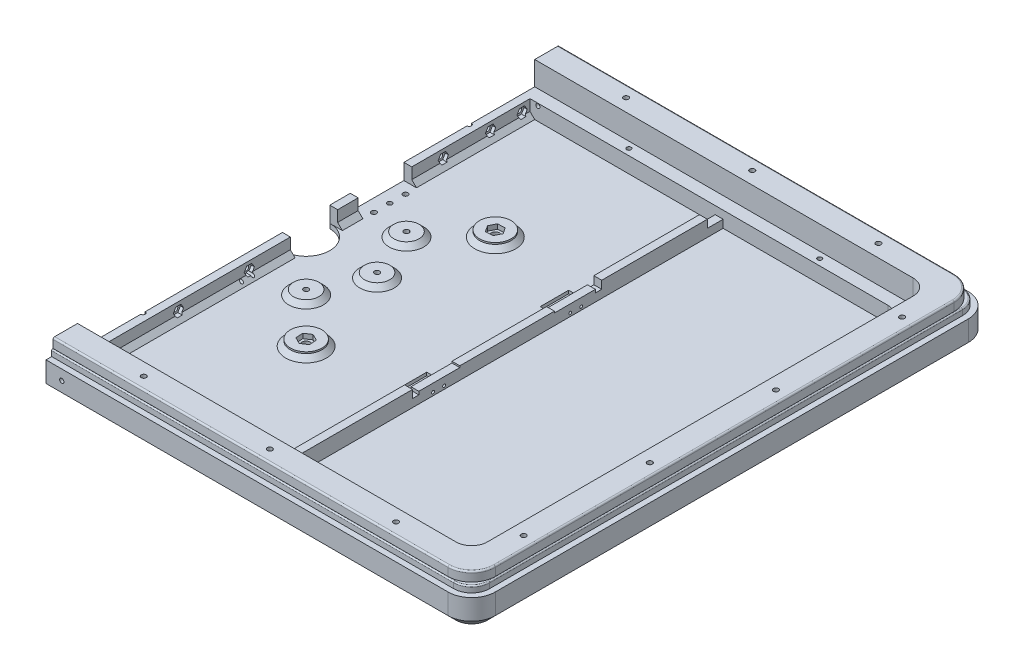
from build123d import *

# Parameters (mm, degrees)
SKETCH1_W                       = 540
SKETCH1_H                       = 330
BOSS_EXTRUDE1_DEPTH             = 3
SKETCH2_W                       = 540
SKETCH2_H                       = 330
SKETCH2_W_2                     = 500
SKETCH2_H_2                     = 290
BOSS_EXTRUDE2_DEPTH             = 25
FILLET1_R                       = 15
SKETCH4_R                       = 1.6
CUT_EXTRUDE1_DEPTH              = 28
SKETCH5_R                       = 15
CUT_EXTRUDE2_DEPTH              = 3
CHAMFER1_SIZE                   = 5
SKETCH7_R                       = 2.6
CUT_EXTRUDE3_DEPTH              = 3
SKETCH9_R                       = 1.6
CUT_EXTRUDE4_DEPTH              = 47
CUT_EXTRUDE5_DEPTH              = 10
FILLET2_R                       = 1
BOSS_EXTRUDE3_DEPTH             = 4
FILLET4_R                       = 0.8
SKETCH23_W                      = 10
SKETCH23_H                      = 130
SKETCH23_W_2                    = 5
SKETCH23_H_2                    = 290
BOSS_EXTRUDE4_DEPTH             = 10
SKETCH24_W                      = 500
SKETCH24_H                      = 290
SKETCH24_W_2                    = 484
SKETCH24_H_2                    = 274
BOSS_EXTRUDE5_DEPTH             = 10
CUT_EXTRUDE6_REACH              = 433.295
SKETCH25_R                      = 0.9
SKETCH26_W                      = 10
SKETCH26_H                      = 18
CUT_EXTRUDE7_DEPTH              = 2
SKETCH27_W                      = 5
SKETCH27_H                      = 30
CUT_EXTRUDE8_DEPTH              = 3
SKETCH28_W                      = 5
SKETCH28_H                      = 60
CUT_EXTRUDE9_DEPTH              = 2
SKETCH29_W                      = 5
SKETCH29_H                      = 4
CUT_EXTRUDE10_DEPTH             = 2
SKETCH31_W                      = 16
SKETCH31_H                      = 34
BOSS_EXTRUDE6_DEPTH             = 53
BOSS_EXTRUDE6_DIRECTION_2_REACH = 318.781
FILLET5_R                       = 15
SKETCH34_R                      = 3
CUT_EXTRUDE11_DEPTH             = 53
SKETCH35_R                      = 8
SKETCH35_R_2                    = 1.6
BOSS_EXTRUDE7_DEPTH             = 3
CHAMFER2_SIZE                   = 3
SKETCH37_W                      = 16
SKETCH37_H                      = 34
CUT_EXTRUDE12_DEPTH             = 63
SKETCH38_R                      = 1.6
SKETCH38_R_2                    = 1.5
CUT_EXTRUDE13_DEPTH             = 90
CHAMFER3_SIZE                   = 3
SKETCH39_R                      = 1.4
CUT_EXTRUDE14_DEPTH             = 8
FILLET6_R                       = 10
FILLET7_R                       = 10
CUT_EXTRUDE15_DEPTH             = 30
CUT_EXTRUDE15_DEPTH_BACK        = 30
SKETCH41_R                      = 5
CUT_EXTRUDE16_DEPTH             = 10
CUT_EXTRUDE16_DEPTH_BACK        = 30
SKETCH42_R                      = 1.6
CUT_EXTRUDE17_DEPTH             = 17
CUT_EXTRUDE17_DEPTH_BACK        = 2
SKETCH45_R                      = 10
SKETCH45_R_2                    = 2.6
BOSS_EXTRUDE8_DEPTH             = 4
CHAMFER4_SIZE                   = 3
CUT_EXTRUDE18_DEPTH             = 3
CUT_EXTRUDE20_REACH             = 429.298
SKETCH52_R                      = 1.35
CUT_EXTRUDE21_REACH             = 319.662
SKETCH51_W                      = 382.039337846
SKETCH51_H                      = 380.550615879
SKETCH53_W                      = 5
SKETCH53_H                      = 10
CUT_EXTRUDE22_DEPTH             = 5


# Some blends are built 0.0001 mm under size
with BuildPart() as part:
    # Sketch1 → Boss-Extrude1 (new body)
    with BuildSketch(Plane(origin=(0, 0, 0), x_dir=(1, 0, 0), z_dir=(0, 1, 0))):
        Rectangle(SKETCH1_W, SKETCH1_H)
    extrude(amount=BOSS_EXTRUDE1_DEPTH)

    # Sketch2 → Boss-Extrude2 (add)
    with BuildSketch(Plane(origin=(0, 3, 0), x_dir=(1, 0, 0), z_dir=(0, 1, 0))):
        Rectangle(SKETCH2_W, SKETCH2_H)
        Rectangle(SKETCH2_W_2, SKETCH2_H_2, mode=Mode.SUBTRACT)
    extrude(amount=BOSS_EXTRUDE2_DEPTH)

    # Fillet1
    fillet1_edges = [part.edges().sort_by_distance(p)[0] for p in [
        (270, 14, 165),
        (-270, 14, 165),
        (-270, 14, -165),
        (270, 14, -165),
    ]]
    fillet(fillet1_edges, radius=FILLET1_R)

    # Sketch4 → Cut-Extrude1 (cut)
    with BuildSketch(Plane(origin=(0, 28, 0), x_dir=(1, 0, 0), z_dir=(0, 1, 0))):
        with Locations(Location((-258, 120, 0), (0, 0, 270))):
            Circle(SKETCH4_R)
        with Locations(Location((-258, 40, 0), (0, 0, 270))):
            Circle(SKETCH4_R)
        with Locations(Location((-210, 153, 0), (0, 0, 270))):
            Circle(SKETCH4_R)
        with Locations(Location((-130, 153, 0), (0, 0, 270))):
            Circle(SKETCH4_R)
        with Locations(Location((-50, 153, 0), (0, 0, 270))):
            Circle(SKETCH4_R)
        with Locations(Location((50, 153, 0), (0, 0, 90))):
            Circle(SKETCH4_R)
        with Locations(Location((130, 153, 0), (0, 0, 90))):
            Circle(SKETCH4_R)
        with Locations(Location((210, 153, 0), (0, 0, 90))):
            Circle(SKETCH4_R)
        with Locations(Location((258, 40, 0), (0, 0, 90))):
            Circle(SKETCH4_R)
        with Locations(Location((258, 120, 0), (0, 0, 90))):
            Circle(SKETCH4_R)
        with Locations(Location((258, -120, 0), (0, 0, 270))):
            Circle(SKETCH4_R)
        with Locations(Location((258, -40, 0), (0, 0, 270))):
            Circle(SKETCH4_R)
        with Locations(Location((210, -153, 0), (0, 0, 270))):
            Circle(SKETCH4_R)
        with Locations(Location((130, -153, 0), (0, 0, 270))):
            Circle(SKETCH4_R)
        with Locations(Location((50, -153, 0), (0, 0, 270))):
            Circle(SKETCH4_R)
        with Locations(Location((-50, -153, 0), (0, 0, 90))):
            Circle(SKETCH4_R)
        with Locations(Location((-130, -153, 0), (0, 0, 90))):
            Circle(SKETCH4_R)
        with Locations(Location((-210, -153, 0), (0, 0, 90))):
            Circle(SKETCH4_R)
        with Locations(Location((-258, -40, 0), (0, 0, 90))):
            Circle(SKETCH4_R)
        with Locations(Location((-258, -120, 0), (0, 0, 90))):
            Circle(SKETCH4_R)
    extrude(amount=-CUT_EXTRUDE1_DEPTH, mode=Mode.SUBTRACT)

    # Sketch5 → Cut-Extrude2 (cut)
    with BuildSketch(Plane(origin=(0, 3, 0), x_dir=(1, 0, 0), z_dir=(0, 1, 0))):
        with Locations(Location((0, 0, 0), (0, 0, 270))):
            Circle(SKETCH5_R)
    extrude(amount=-CUT_EXTRUDE2_DEPTH, mode=Mode.SUBTRACT)

    # Chamfer1
    chamfer1_edges = [part.edges().sort_by_distance(p)[0] for p in [
        (-270, 0, 0),
        (270, 0, 0),
        (0, 0, 165),
        (0, 0, -165),
        (265.606601718, 0, -160.606601718),
        (265.606601718, 0, 160.606601718),
        (-265.606601718, 0, 160.606601718),
        (-265.606601718, 0, -160.606601718),
    ]]
    chamfer(chamfer1_edges, length=CHAMFER1_SIZE)

    # Sketch7 → Cut-Extrude3 (cut)
    with BuildSketch(Plane.XZ):
        with Locations(Location((-60, 60, 0), (0, 0, 270))):
            Circle(SKETCH7_R)
        with Locations(Location((60, 60, 0), (0, 0, 270))):
            Circle(SKETCH7_R)
        with Locations(Location((60, -60, 0), (0, 0, 270))):
            Circle(SKETCH7_R)
        with Locations(Location((-60, -60, 0), (0, 0, 270))):
            Circle(SKETCH7_R)
    extrude(amount=-CUT_EXTRUDE3_DEPTH, mode=Mode.SUBTRACT)

    # Sketch9 → Cut-Extrude4 (cut)
    with BuildSketch(Plane.XZ):
        with Locations(Location((-31.819805153, 31.819805153, 0), (0, 0, 270))):
            Circle(SKETCH9_R)
        with Locations(Location((31.819805153, 31.819805153, 0), (0, 0, 270))):
            Circle(SKETCH9_R)
        with Locations(Location((31.819805153, -31.819805153, 0), (0, 0, 270))):
            Circle(SKETCH9_R)
        with Locations(Location((-31.819805153, -31.819805153, 0), (0, 0, 270))):
            Circle(SKETCH9_R)
        with Locations(Location((45, 0, 0), (0, 0, 270))):
            Circle(SKETCH9_R)
        with Locations(Location((-45, 0, 0), (0, 0, 270))):
            Circle(SKETCH9_R)
    extrude(amount=-CUT_EXTRUDE4_DEPTH, mode=Mode.SUBTRACT)

    # Sketch19 → Cut-Extrude5 (cut)
    with BuildSketch(Plane(origin=(0, 28, 0), x_dir=(1, 0, 0), z_dir=(0, 1, 0))):
        with BuildLine():
            Line((255, -165), (-255, -165))
            ThreePointArc((-255, -165), (-265.606601718, -160.606601718), (-270, -150))
            Line((-270, -150), (-270, 150))
            ThreePointArc((-270, 150), (-265.606601718, 160.606601718), (-255, 165))
            Line((-255, 165), (255, 165))
            ThreePointArc((255, 165), (265.606601718, 160.606601718), (270, 150))
            Line((270, 150), (270, -150))
            ThreePointArc((270, -150), (265.606601718, -160.606601718), (255, -165))
        make_face()
        with BuildLine():
            Line((250.5, 160.5), (-250.5, 160.5))
            ThreePointArc((-250.5, 160.5), (-261.106601718, 156.106601718), (-265.5, 145.5))
            Line((-265.5, 145.5), (-265.5, -145.5))
            ThreePointArc((-265.5, -145.5), (-261.106601718, -156.106601718), (-250.5, -160.5))
            Line((-250.5, -160.5), (250.5, -160.5))
            ThreePointArc((250.5, -160.5), (261.106601718, -156.106601718), (265.5, -145.5))
            Line((265.5, -145.5), (265.5, 145.5))
            ThreePointArc((265.5, 145.5), (261.106601718, 156.106601718), (250.5, 160.5))
        make_face(mode=Mode.SUBTRACT)
    extrude(amount=-CUT_EXTRUDE5_DEPTH, mode=Mode.SUBTRACT)

    # Fillet2
    fillet2_edges = [part.edges().sort_by_distance(p)[0] for p in [
        (-261.106601718, 28, -156.106601718),
        (0, 28, -160.5),
        (261.106601718, 28, -156.106601718),
        (265.5, 28, 0),
        (261.106601718, 28, 156.106601718),
        (0, 28, 160.5),
        (-261.106601718, 28, 156.106601718),
        (-265.5, 28, 0),
    ]]
    fillet(fillet2_edges, radius=FILLET2_R)

    # Sketch20 → Boss-Extrude3 (add)
    with BuildSketch(Plane(origin=(0, 18, 0), x_dir=(1, 0, 0), z_dir=(0, 1, 0))):
        with BuildLine():
            Line((-255, 161.4), (255, 161.4))
            ThreePointArc((255, 161.4), (263.061017306, 158.061017306), (266.4, 150))
            Line((266.4, 150), (266.4, -150))
            ThreePointArc((266.4, -150), (263.061017306, -158.061017306), (255, -161.4))
            Line((255, -161.4), (-255, -161.4))
            ThreePointArc((-255, -161.4), (-263.061017306, -158.061017306), (-266.4, -150))
            Line((-266.4, -150), (-266.4, 150))
            ThreePointArc((-266.4, 150), (-263.061017306, 158.061017306), (-255, 161.4))
        make_face()
        with BuildLine():
            Line((-255, 157.9), (255, 157.9))
            ThreePointArc((255, 157.9), (260.586143571, 155.586143571), (262.9, 150))
            Line((262.9, 150), (262.9, -150))
            ThreePointArc((262.9, -150), (260.586143571, -155.586143571), (255, -157.9))
            Line((255, -157.9), (-255, -157.9))
            ThreePointArc((-255, -157.9), (-260.586143571, -155.586143571), (-262.9, -150))
            Line((-262.9, -150), (-262.9, 150))
            ThreePointArc((-262.9, 150), (-260.586143571, 155.586143571), (-255, 157.9))
        make_face(mode=Mode.SUBTRACT)
    extrude(amount=BOSS_EXTRUDE3_DEPTH)

    # Fillet4
    fillet4_edges = [part.edges().sort_by_distance(p)[0] for p in [
        (-263.061017306, 22, -158.061017306),
        (-266.4, 22, 0),
        (-263.061017306, 22, 158.061017306),
        (0, 22, 161.4),
        (263.061017306, 22, 158.061017306),
        (266.4, 22, 0),
        (263.061017306, 22, -158.061017306),
        (0, 22, -161.4),
    ]]
    fillet(fillet4_edges, radius=FILLET4_R)

    # Sketch23 → Boss-Extrude4 (add)
    with BuildSketch(Plane(origin=(0, 3, 0), x_dir=(1, 0, 0), z_dir=(0, 1, 0))):
        with Locations((0, 80)):
            Rectangle(SKETCH23_W, SKETCH23_H)
        with Locations((0, -80)):
            Rectangle(SKETCH23_W, SKETCH23_H)
        with Locations((125, 0)):
            Rectangle(SKETCH23_W_2, SKETCH23_H_2)
        with Locations((-125, 0)):
            Rectangle(SKETCH23_W_2, SKETCH23_H_2)
    extrude(amount=BOSS_EXTRUDE4_DEPTH)

    # Sketch24 → Boss-Extrude5 (add)
    with BuildSketch(Plane(origin=(0, 3, 0), x_dir=(1, 0, 0), z_dir=(0, 1, 0))):
        Rectangle(SKETCH24_W, SKETCH24_H)
        Rectangle(SKETCH24_W_2, SKETCH24_H_2, mode=Mode.SUBTRACT)
    extrude(amount=BOSS_EXTRUDE5_DEPTH)

    # Cut-Extrude6: up to this face of the body (flat: up to its plane)
    cut_extrude6_end = Plane(part.part.faces().sort_by_distance((-127.5, 8, 0))[0])
    # Sketch25 → Cut-Extrude6 (cut, up to the picked face)
    with BuildSketch(Plane(origin=(127.5, 0, 0), x_dir=(0, 0, -1), z_dir=(1, 0, 0)), mode=Mode.PRIVATE) as cut_extrude6_sk1:
        with Locations(Location((-47, 5, 0), (0, 0, 180))):
            Circle(SKETCH25_R)
    cut_extrude6_tool1 = split(extrude(cut_extrude6_sk1.sketch, amount=-CUT_EXTRUDE6_REACH, mode=Mode.PRIVATE), bisect_by=cut_extrude6_end, keep=Keep.BOTH, mode=Mode.PRIVATE)
    # Sketch25 → Cut-Extrude6 (cut, up to the picked face)
    with BuildSketch(Plane(origin=(127.5, 0, 0), x_dir=(0, 0, -1), z_dir=(1, 0, 0)), mode=Mode.PRIVATE) as cut_extrude6_sk2:
        with Locations(Location((-40, 5, 0), (0, 0, 180))):
            Circle(SKETCH25_R)
    cut_extrude6_tool2 = split(extrude(cut_extrude6_sk2.sketch, amount=-CUT_EXTRUDE6_REACH, mode=Mode.PRIVATE), bisect_by=cut_extrude6_end, keep=Keep.BOTH, mode=Mode.PRIVATE)
    # Sketch25 → Cut-Extrude6 (cut, up to the picked face)
    with BuildSketch(Plane(origin=(127.5, 0, 0), x_dir=(0, 0, -1), z_dir=(1, 0, 0)), mode=Mode.PRIVATE) as cut_extrude6_sk3:
        with Locations(Location((47, 5, 0), (0, 0, 180))):
            Circle(SKETCH25_R)
    cut_extrude6_tool3 = split(extrude(cut_extrude6_sk3.sketch, amount=-CUT_EXTRUDE6_REACH, mode=Mode.PRIVATE), bisect_by=cut_extrude6_end, keep=Keep.BOTH, mode=Mode.PRIVATE)
    # Sketch25 → Cut-Extrude6 (cut, up to the picked face)
    with BuildSketch(Plane(origin=(127.5, 0, 0), x_dir=(0, 0, -1), z_dir=(1, 0, 0)), mode=Mode.PRIVATE) as cut_extrude6_sk4:
        with Locations(Location((40, 5, 0), (0, 0, 180))):
            Circle(SKETCH25_R)
    cut_extrude6_tool4 = split(extrude(cut_extrude6_sk4.sketch, amount=-CUT_EXTRUDE6_REACH, mode=Mode.PRIVATE), bisect_by=cut_extrude6_end, keep=Keep.BOTH, mode=Mode.PRIVATE)
    add(cut_extrude6_tool1.solids().sort_by(Axis((127.5, 5, 47), (-1, 0, 0)))[0], mode=Mode.SUBTRACT)
    add(cut_extrude6_tool2.solids().sort_by(Axis((127.5, 5, 40), (-1, 0, 0)))[0], mode=Mode.SUBTRACT)
    add(cut_extrude6_tool3.solids().sort_by(Axis((127.5, 5, -47), (-1, 0, 0)))[0], mode=Mode.SUBTRACT)
    add(cut_extrude6_tool4.solids().sort_by(Axis((127.5, 5, -40), (-1, 0, 0)))[0], mode=Mode.SUBTRACT)

    # Sketch26 → Cut-Extrude7 (cut)
    with BuildSketch(Plane(origin=(0, 3, 0), x_dir=(1, 0, 0), z_dir=(0, 1, 0))):
        with Locations((-117.5, -45)):
            Rectangle(SKETCH26_W, SKETCH26_H)
        with Locations((-117.5, 45)):
            Rectangle(SKETCH26_W, SKETCH26_H)
        with Locations((117.5, -45)):
            Rectangle(SKETCH26_W, SKETCH26_H)
        with Locations((117.5, 45)):
            Rectangle(SKETCH26_W, SKETCH26_H)
    extrude(amount=-CUT_EXTRUDE7_DEPTH, mode=Mode.SUBTRACT)

    # Sketch27 → Cut-Extrude8 (cut)
    with BuildSketch(Plane(origin=(0, 13, 0), x_dir=(1, 0, 0), z_dir=(0, 1, 0))):
        with Locations((-125, -45)):
            Rectangle(SKETCH27_W, SKETCH27_H)
        with Locations((-125, 45)):
            Rectangle(SKETCH27_W, SKETCH27_H)
        with Locations((125, 45)):
            Rectangle(SKETCH27_W, SKETCH27_H)
        with Locations((125, -45)):
            Rectangle(SKETCH27_W, SKETCH27_H)
    extrude(amount=-CUT_EXTRUDE8_DEPTH, mode=Mode.SUBTRACT)

    # Sketch28 → Cut-Extrude9 (cut)
    with BuildSketch(Plane(origin=(0, 13, 0), x_dir=(1, 0, 0), z_dir=(0, 1, 0))):
        with Locations((-125, 0)):
            Rectangle(SKETCH28_W, SKETCH28_H)
        with Locations((125, 0)):
            Rectangle(SKETCH28_W, SKETCH28_H)
    extrude(amount=-CUT_EXTRUDE9_DEPTH, mode=Mode.SUBTRACT)

    # Sketch29 → Cut-Extrude10 (cut)
    with BuildSketch(Plane(origin=(0, 10, 0), x_dir=(1, 0, 0), z_dir=(0, 1, 0))):
        with Locations((-125, 58)):
            Rectangle(SKETCH29_W, SKETCH29_H)
        with Locations((-125, -58)):
            Rectangle(SKETCH29_W, SKETCH29_H)
        with Locations((125, -58)):
            Rectangle(SKETCH29_W, SKETCH29_H)
        with Locations((125, 58)):
            Rectangle(SKETCH29_W, SKETCH29_H)
    extrude(amount=-CUT_EXTRUDE10_DEPTH, mode=Mode.SUBTRACT)

    # Sketch31 → Boss-Extrude6 (add)
    with BuildSketch(Plane(origin=(0, 13, 0), x_dir=(1, 0, 0), z_dir=(0, 1, 0))):
        with Locations((0, 45)):
            Rectangle(SKETCH31_W, SKETCH31_H)
    extrude(amount=BOSS_EXTRUDE6_DEPTH)

    # Boss-Extrude6 direction 2: up to this face of the body (flat: up to its plane)
    boss_extrude6_direction_2_end = Plane(part.part.faces().sort_by_distance((-63.514526325, 3, 0))[0])
    # Sketch31 → Boss-Extrude6 direction 2 (add, up to the picked face)
    with BuildSketch(Plane(origin=(0, 13, 0), x_dir=(1, 0, 0), z_dir=(0, 1, 0)), mode=Mode.PRIVATE) as boss_extrude6_direction_2_sk1:
        with Locations((0, 45)):
            Rectangle(SKETCH31_W, SKETCH31_H)
    boss_extrude6_direction_2_tool1 = split(extrude(boss_extrude6_direction_2_sk1.sketch, amount=-BOSS_EXTRUDE6_DIRECTION_2_REACH, mode=Mode.PRIVATE), bisect_by=boss_extrude6_direction_2_end, keep=Keep.BOTH, mode=Mode.PRIVATE)
    add(boss_extrude6_direction_2_tool1.solids().sort_by(Axis((0, 13, -45), (0, -1, 0)))[0])

    # Fillet5
    fillet5_edges = [part.edges().sort_by_distance(p)[0] for p in [
        (0, 66, -62),
        (0, 66, -28),
    ]]
    fillet(fillet5_edges, radius=FILLET5_R)

    # Sketch34 → Cut-Extrude11 (cut)
    with BuildSketch(Plane.ZY.offset(8)):
        with Locations((-45, 53)):
            Circle(SKETCH34_R)
    extrude(amount=-CUT_EXTRUDE11_DEPTH, mode=Mode.SUBTRACT)

    # Sketch35 → Boss-Extrude7 (add)
    # profile 1 of 6: a face of its own
    with BuildSketch(Plane(origin=(0, 3, 0), x_dir=(1, 0, 0), z_dir=(0, 1, 0))):
        with Locations(Location((-31.819805153, 31.819805153, 0), (0, 0, 90))):
            Circle(SKETCH35_R)
        with Locations(Location((-31.819805153, 31.819805153, 0), (0, 0, 90))):
            Circle(SKETCH35_R_2, mode=Mode.SUBTRACT)
    # profile 2 of 6: a face of its own
    with BuildSketch(Plane(origin=(0, 3, 0), x_dir=(1, 0, 0), z_dir=(0, 1, 0))):
        with Locations(Location((31.819805153, 31.819805153, 0), (0, 0, 90))):
            Circle(SKETCH35_R)
        with Locations(Location((31.819805153, 31.819805153, 0), (0, 0, 90))):
            Circle(SKETCH35_R_2, mode=Mode.SUBTRACT)
    # profile 3 of 6: a face of its own
    with BuildSketch(Plane(origin=(0, 3, 0), x_dir=(1, 0, 0), z_dir=(0, 1, 0))):
        with Locations(Location((31.819805153, -31.819805153, 0), (0, 0, 90))):
            Circle(SKETCH35_R)
        with Locations(Location((31.819805153, -31.819805153, 0), (0, 0, 90))):
            Circle(SKETCH35_R_2, mode=Mode.SUBTRACT)
    # profile 4 of 6: a face of its own
    with BuildSketch(Plane(origin=(0, 3, 0), x_dir=(1, 0, 0), z_dir=(0, 1, 0))):
        with Locations(Location((-31.819805153, -31.819805153, 0), (0, 0, 90))):
            Circle(SKETCH35_R)
        with Locations(Location((-31.819805153, -31.819805153, 0), (0, 0, 90))):
            Circle(SKETCH35_R_2, mode=Mode.SUBTRACT)
    # profile 5 of 6: a face of its own
    with BuildSketch(Plane(origin=(0, 3, 0), x_dir=(1, 0, 0), z_dir=(0, 1, 0))):
        with Locations(Location((-45, 0, 0), (0, 0, 90))):
            Circle(SKETCH35_R)
        with Locations(Location((-45, 0, 0), (0, 0, 270))):
            Circle(SKETCH35_R_2, mode=Mode.SUBTRACT)
    # profile 6 of 6: a face of its own
    with BuildSketch(Plane(origin=(0, 3, 0), x_dir=(1, 0, 0), z_dir=(0, 1, 0))):
        with Locations(Location((45, 0, 0), (0, 0, 90))):
            Circle(SKETCH35_R)
        with Locations(Location((45, 0, 0), (0, 0, 90))):
            Circle(SKETCH35_R_2, mode=Mode.SUBTRACT)
    extrude(amount=BOSS_EXTRUDE7_DEPTH)

    # Chamfer2
    chamfer2_edges = [part.edges().sort_by_distance(p)[0] for p in [
        (-31.819805153, 3, -23.819805153),
        (-45, 3, 8),
        (31.819805153, 3, -23.819805153),
        (31.819805153, 3, 39.819805153),
        (-31.819805153, 3, 39.819805153),
        (45, 3, 8),
    ]]
    chamfer(chamfer2_edges, length=CHAMFER2_SIZE - 0.0001)  # a hair under: the kernel refuses the full size

    # Sketch37 → Cut-Extrude12 (cut)
    with BuildSketch(Plane(origin=(0, 66, 0), x_dir=(1, 0, 0), z_dir=(0, 1, 0))):
        with Locations((0, 45)):
            Rectangle(SKETCH37_W, SKETCH37_H)
    extrude(amount=-CUT_EXTRUDE12_DEPTH, mode=Mode.SUBTRACT)

    # Sketch38 → Cut-Extrude13 (cut)
    with BuildSketch(Plane(origin=(0, 3, 0), x_dir=(1, 0, 0), z_dir=(0, 1, 0))):
        with Locations(Location((8, 55, 0), (0, 0, 270))):
            Circle(SKETCH38_R)
        with Locations(Location((8, 35, 0), (0, 0, 270))):
            Circle(SKETCH38_R)
        with Locations(Location((-8, 35, 0), (0, 0, 270))):
            Circle(SKETCH38_R)
        with Locations(Location((-8, 55, 0), (0, 0, 270))):
            Circle(SKETCH38_R)
        with Locations(Location((8, 45, 0), (0, 0, 270))):
            Circle(SKETCH38_R_2)
        with Locations(Location((-8, 45, 0), (0, 0, 270))):
            Circle(SKETCH38_R_2)
    extrude(amount=-CUT_EXTRUDE13_DEPTH, mode=Mode.SUBTRACT)

    # Chamfer3
    # the kernel refuses this chamfer: 3 mm, written as the material it adds along each edge
    with BuildSketch(Plane(origin=(5, 3, -15), x_dir=(0.9996219169112969, -0.027495876610586348, 0), z_dir=(0, 0, -1)), Plane(origin=(-5, 3, -28), x_dir=(-0.9996219169112968, -0.027495876610586358, 0), z_dir=(0, 0, 1))) as chamfer3_piece_1:
        Polygon((CHAMFER3_SIZE * 0.999621916911, -CHAMFER3_SIZE * 0.0274958766106), (-CHAMFER3_SIZE * 0.0274958766106, -CHAMFER3_SIZE * 0.999621916911), (0, 0), align=None)
    extrude(amount=13)
    with BuildSketch(Plane(origin=(5, 3, 144.715048964), x_dir=(0.9996219169112969, -0.027495876610586348, 0), z_dir=(0, 0, -1))) as chamfer3_piece_2_section:
        Polygon((CHAMFER3_SIZE * 0.999621916911, -CHAMFER3_SIZE * 0.0274958766106), (-CHAMFER3_SIZE * 0.0274958766106, -CHAMFER3_SIZE * 0.999621916911), (0, 0), align=None)
    chamfer3_piece_2 = extrude(amount=129.715048964, mode=Mode.PRIVATE)
    chamfer3_piece_2 = chamfer3_piece_2 - Plane(origin=(5.98938088, 5, 47), x_dir=(0, 0, 1), z_dir=(1, 0, 0)) * Cylinder(0.9, 272, mode=Mode.PRIVATE)
    chamfer3_piece_2 = chamfer3_piece_2 - Plane(origin=(5.98938088, 5, 40), x_dir=(0, 0, 1), z_dir=(1, 0, 0)) * Cylinder(0.9, 272, mode=Mode.PRIVATE)
    add(chamfer3_piece_2)
    with BuildSketch(Plane(origin=(-5, 3, 15), x_dir=(-0.9996219169112968, -0.027495876610586358, 0), z_dir=(0, 0, 1))) as chamfer3_piece_3_section:
        Polygon((CHAMFER3_SIZE * 0.999621916911, -CHAMFER3_SIZE * 0.0274958766106), (-CHAMFER3_SIZE * 0.0274958766106, -CHAMFER3_SIZE * 0.999621916911), (0, 0), align=None)
    chamfer3_piece_3 = extrude(amount=129.715048964, mode=Mode.PRIVATE)
    chamfer3_piece_3 = chamfer3_piece_3 - Plane(origin=(-5.993381488, 5, 47), x_dir=(0, 0, 1), z_dir=(1, 0, 0)) * Cylinder(0.9, 272, mode=Mode.PRIVATE)
    chamfer3_piece_3 = chamfer3_piece_3 - Plane(origin=(-5.993381488, 5, 40), x_dir=(0, 0, 1), z_dir=(1, 0, 0)) * Cylinder(0.9, 272, mode=Mode.PRIVATE)
    add(chamfer3_piece_3)
    with BuildSketch(Plane(origin=(5, 3, -62), x_dir=(0.9996219169112969, -0.027495876610586348, 0), z_dir=(0, 0, -1)), Plane(origin=(-5, 3, -144.715048964), x_dir=(-0.9996219169112968, -0.027495876610586358, 0), z_dir=(0, 0, 1))) as chamfer3_piece_4:
        Polygon((CHAMFER3_SIZE * 0.999621916911, -CHAMFER3_SIZE * 0.0274958766106), (-CHAMFER3_SIZE * 0.0274958766106, -CHAMFER3_SIZE * 0.999621916911), (0, 0), align=None)
    extrude(amount=82.715048964)

    # Sketch39 → Cut-Extrude14 (cut)
    with BuildSketch(Plane(origin=(0, 13, 0), x_dir=(1, 0, 0), z_dir=(0, 1, 0))):
        with Locations(Location((-246, 68.5, 0), (0, 0, 270))):
            Circle(SKETCH39_R)
        with Locations(Location((-184.75, 141, 0), (0, 0, 270))):
            Circle(SKETCH39_R)
        with Locations(Location((-63.75, 141, 0), (0, 0, 270))):
            Circle(SKETCH39_R)
        with Locations(Location((63.75, 141, 0), (0, 0, 90))):
            Circle(SKETCH39_R)
        with Locations(Location((184.75, 141, 0), (0, 0, 90))):
            Circle(SKETCH39_R)
        with Locations(Location((246, 68.5, 0), (0, 0, 90))):
            Circle(SKETCH39_R)
        with Locations(Location((0, 103.5, 0), (0, 0, 270))):
            Circle(SKETCH39_R)
        with Locations(Location((0, -103.5, 0), (0, 0, 90))):
            Circle(SKETCH39_R)
        with Locations(Location((246, -68.5, 0), (0, 0, 270))):
            Circle(SKETCH39_R)
        with Locations(Location((184.75, -141, 0), (0, 0, 270))):
            Circle(SKETCH39_R)
        with Locations(Location((63.75, -141, 0), (0, 0, 270))):
            Circle(SKETCH39_R)
        with Locations(Location((-63.75, -141, 0), (0, 0, 90))):
            Circle(SKETCH39_R)
        with Locations(Location((-184.75, -141, 0), (0, 0, 90))):
            Circle(SKETCH39_R)
        with Locations(Location((-246, -68.5, 0), (0, 0, 90))):
            Circle(SKETCH39_R)
    extrude(amount=-CUT_EXTRUDE14_DEPTH, mode=Mode.SUBTRACT)

    # Fillet6
    fillet6_edges = [part.edges().sort_by_distance(p)[0] for p in [
        (242, 8, 137),
        (-242, 8, -137),
        (242, 8, -137),
        (-242, 8, 137),
    ]]
    fillet(fillet6_edges, radius=FILLET6_R)

    # Fillet7
    fillet7_edges = [part.edges().sort_by_distance(p)[0] for p in [
        (250, 20.5, -145),
        (-250, 20.5, -145),
        (-250, 20.5, 145),
        (250, 20.5, 145),
    ]]
    fillet(fillet7_edges, radius=FILLET7_R)

    # Sketch41 → Cut-Extrude15 (cut, two sides: drawn at the far end of the back side and taken through both)
    with BuildSketch(Plane(origin=(0, 0, 0), x_dir=(0, 0, -1), z_dir=(1, 0, 0)).offset(-CUT_EXTRUDE15_DEPTH_BACK)):
        with Locations((153, 11.5)):
            Circle(SKETCH41_R)
        with Locations(Location((-153, 11.5, 0), (0, 0, 180))):
            Circle(SKETCH41_R)
    extrude(amount=CUT_EXTRUDE15_DEPTH + CUT_EXTRUDE15_DEPTH_BACK, mode=Mode.SUBTRACT)

    # Sketch42 → Cut-Extrude16 (cut, two sides: drawn at the far end of the back side and taken through both)
    with BuildSketch(Plane(origin=(5, 0, 0), x_dir=(0, 0, -1), z_dir=(1, 0, 0)).offset(-CUT_EXTRUDE16_DEPTH_BACK)):
        with Locations(Location((112, 8, 0), (0, 0, 180))):
            Circle(SKETCH42_R)
        with Locations(Location((132, 8, 0), (0, 0, 180))):
            Circle(SKETCH42_R)
        with Locations(Location((82, 8, 0), (0, 0, 180))):
            Circle(SKETCH42_R)
        with Locations(Location((-86, 8, 0), (0, 0, 180))):
            Circle(SKETCH42_R)
        with Locations(Location((-132, 8, 0), (0, 0, 180))):
            Circle(SKETCH42_R)
        with Locations(Location((-41.05, 8, 0), (0, 0, 180))):
            Circle(SKETCH42_R)
    extrude(amount=CUT_EXTRUDE16_DEPTH + CUT_EXTRUDE16_DEPTH_BACK, mode=Mode.SUBTRACT)

    # Sketch43 → Cut-Extrude17 (cut, two sides: drawn at the far end of the back side and taken through both)
    with BuildSketch(Plane(origin=(5, 0, 0), x_dir=(0, 0, -1), z_dir=(1, 0, 0)).offset(-CUT_EXTRUDE17_DEPTH_BACK)):
        Polygon((-87.616580754, 10.8), (-89.233161507, 8), (-87.616580754, 5.2), (-84.383419246, 5.2), (-82.766838493, 8), (-84.383419246, 10.8), align=None)
        Polygon((-128.766838493, 8), (-130.383419246, 10.8), (-133.616580754, 10.8), (-135.233161507, 8), (-133.616580754, 5.2), (-130.383419246, 5.2), align=None)
        Polygon((-37.816838493, 8), (-39.433419246, 10.8), (-42.666580754, 10.8), (-44.283161507, 8), (-42.666580754, 5.2), (-39.433419246, 5.2), align=None)
        Polygon((85.233161507, 8), (83.616580754, 10.8), (80.383419246, 10.8), (78.766838493, 8), (80.383419246, 5.2), (83.616580754, 5.2), align=None)
        Polygon((115.233161507, 8), (113.616580754, 10.8), (110.383419246, 10.8), (108.766838493, 8), (110.383419246, 5.2), (113.616580754, 5.2), align=None)
        Polygon((130.383419246, 10.8), (128.766838493, 8), (130.383419246, 5.2), (133.616580754, 5.2), (135.233161507, 8), (133.616580754, 10.8), align=None)
    extrude(amount=CUT_EXTRUDE17_DEPTH + CUT_EXTRUDE17_DEPTH_BACK, mode=Mode.SUBTRACT)

    # Sketch45 → Boss-Extrude8 (add)
    # profile 1 of 4: a face of its own
    with BuildSketch(Plane(origin=(0, 3, 0), x_dir=(1, 0, 0), z_dir=(0, 1, 0))):
        with Locations(Location((-60, 60, 0), (0, 0, 90))):
            Circle(SKETCH45_R)
        with Locations(Location((-60, 60, 0), (0, 0, 90))):
            Circle(SKETCH45_R_2, mode=Mode.SUBTRACT)
    # profile 2 of 4: a face of its own
    with BuildSketch(Plane(origin=(0, 3, 0), x_dir=(1, 0, 0), z_dir=(0, 1, 0))):
        with Locations(Location((60, 60, 0), (0, 0, 90))):
            Circle(SKETCH45_R)
        with Locations(Location((60, 60, 0), (0, 0, 90))):
            Circle(SKETCH45_R_2, mode=Mode.SUBTRACT)
    # profile 3 of 4: a face of its own
    with BuildSketch(Plane(origin=(0, 3, 0), x_dir=(1, 0, 0), z_dir=(0, 1, 0))):
        with Locations(Location((60, -60, 0), (0, 0, 90))):
            Circle(SKETCH45_R)
        with Locations(Location((60, -60, 0), (0, 0, 90))):
            Circle(SKETCH45_R_2, mode=Mode.SUBTRACT)
    # profile 4 of 4: a face of its own
    with BuildSketch(Plane(origin=(0, 3, 0), x_dir=(1, 0, 0), z_dir=(0, 1, 0))):
        with Locations(Location((-60, -60, 0), (0, 0, 90))):
            Circle(SKETCH45_R)
        with Locations(Location((-60, -60, 0), (0, 0, 90))):
            Circle(SKETCH45_R_2, mode=Mode.SUBTRACT)
    extrude(amount=BOSS_EXTRUDE8_DEPTH)

    # Chamfer4
    chamfer4_edges = [part.edges().sort_by_distance(p)[0] for p in [
        (-60, 3, -50),
        (60, 3, -50),
        (60, 3, 70),
        (-60, 3, 70),
    ]]
    chamfer(chamfer4_edges, length=CHAMFER4_SIZE)

    # Sketch48 → Cut-Extrude18 (cut)
    with BuildSketch(Plane(origin=(0, 7, 0), x_dir=(1, 0, 0), z_dir=(0, 1, 0))):
        Polygon((62.567013443, 56.090979409), (64.668817858, 60.268588558), (62.101804414, 64.177609149), (57.432986557, 63.909020591), (55.331182143, 59.731411442), (57.898195586, 55.822390851), align=None)
        Polygon((-56.090979409, 62.567013443), (-60.268588558, 64.668817857), (-64.177609149, 62.101804414), (-63.909020591, 57.432986557), (-59.731411442, 55.331182143), (-55.822390851, 57.898195586), align=None)
        Polygon((56.090979409, -62.567013443), (60.268588558, -64.668817857), (64.177609149, -62.101804414), (63.909020591, -57.432986557), (59.731411442, -55.331182143), (55.822390851, -57.898195586), align=None)
        Polygon((-62.567013443, -56.090979409), (-64.668817857, -60.268588558), (-62.101804414, -64.177609149), (-57.432986557, -63.909020591), (-55.331182143, -59.731411442), (-57.898195586, -55.822390851), align=None)
    extrude(amount=-CUT_EXTRUDE18_DEPTH, mode=Mode.SUBTRACT)

    # Cut-Extrude20: up to this face of the body (flat: up to its plane)
    cut_extrude20_end = Plane(part.part.faces().sort_by_distance((0, 11.5, -165))[0])
    # Sketch52 → Cut-Extrude20 (cut, up to the picked face)
    with BuildSketch(Plane.XY.offset(165), mode=Mode.PRIVATE) as cut_extrude20_sk1:
        with Locations((-10, 11.5)):
            Circle(SKETCH52_R)
    cut_extrude20_tool1 = split(extrude(cut_extrude20_sk1.sketch, amount=-CUT_EXTRUDE20_REACH, mode=Mode.PRIVATE), bisect_by=cut_extrude20_end, keep=Keep.BOTH, mode=Mode.PRIVATE)
    # Sketch52 → Cut-Extrude20 (cut, up to the picked face)
    with BuildSketch(Plane.XY.offset(165), mode=Mode.PRIVATE) as cut_extrude20_sk2:
        with Locations((10, 11.5)):
            Circle(SKETCH52_R)
    cut_extrude20_tool2 = split(extrude(cut_extrude20_sk2.sketch, amount=-CUT_EXTRUDE20_REACH, mode=Mode.PRIVATE), bisect_by=cut_extrude20_end, keep=Keep.BOTH, mode=Mode.PRIVATE)
    add(cut_extrude20_tool1.solids().sort_by(Axis((-10, 11.5, 165), (0, 0, -1)))[0], mode=Mode.SUBTRACT)
    add(cut_extrude20_tool2.solids().sort_by(Axis((10, 11.5, 165), (0, 0, -1)))[0], mode=Mode.SUBTRACT)

    # Cut-Extrude21: up to this face of the body (flat: up to its plane)
    cut_extrude21_end = Plane(part.part.faces().sort_by_distance((-258.808877323, 0, 0))[0])
    # Sketch51 → Cut-Extrude21 (cut, up to the picked face)
    with BuildSketch(Plane(origin=(0, 28, 0), x_dir=(1, 0, 0), z_dir=(0, 1, 0)), mode=Mode.PRIVATE) as cut_extrude21_sk1:
        with Locations((-191.019668923, -25.27530794)):
            Rectangle(SKETCH51_W, SKETCH51_H)
    cut_extrude21_tool1 = split(extrude(cut_extrude21_sk1.sketch, amount=-CUT_EXTRUDE21_REACH, mode=Mode.PRIVATE), bisect_by=cut_extrude21_end, keep=Keep.BOTH, mode=Mode.PRIVATE)
    add(cut_extrude21_tool1.solids().sort_by(Axis((-191.019669, 28, 25.275308), (0, -1, 0)))[0], mode=Mode.SUBTRACT)

    # Sketch53 → Cut-Extrude22 (cut)
    with BuildSketch(Plane(origin=(0, 13, 0), x_dir=(1, 0, 0), z_dir=(0, 1, 0))):
        with Locations((125, 132)):
            Rectangle(SKETCH53_W, SKETCH53_H)
    extrude(amount=-CUT_EXTRUDE22_DEPTH, mode=Mode.SUBTRACT)


solid = part.part
